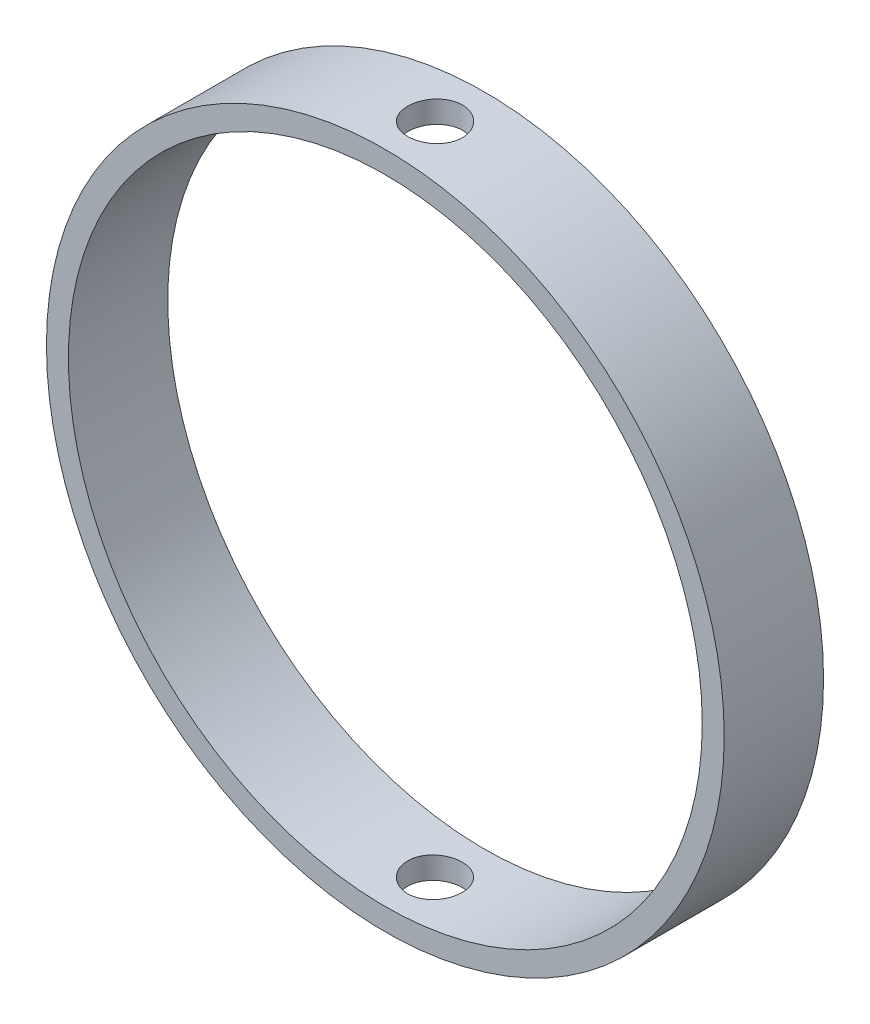
from build123d import *

# Parameters (mm, degrees)
SKETCH1_R           = 34.11
SKETCH1_R_2         = 31.9
BOSS_EXTRUDE1_DEPTH = 10
SKETCH2_R           = 2.75
CUT_EXTRUDE1_DEPTH  = 77.925031687


with BuildPart() as part:
    # Sketch1 → Boss-Extrude1 (new body)
    with BuildSketch(Plane.XY):
        Circle(SKETCH1_R)
        Circle(SKETCH1_R_2, mode=Mode.SUBTRACT)
    extrude(amount=BOSS_EXTRUDE1_DEPTH)

    # Sketch2 → Cut-Extrude1 (cut, through all)
    with BuildSketch(Plane(origin=(0, 34.11, 0), x_dir=(1, 0, 0), z_dir=(0, 1, 0))):
        with Locations((0, -5)):
            Circle(SKETCH2_R)
    extrude(amount=-CUT_EXTRUDE1_DEPTH, mode=Mode.SUBTRACT)


solid = part.part
